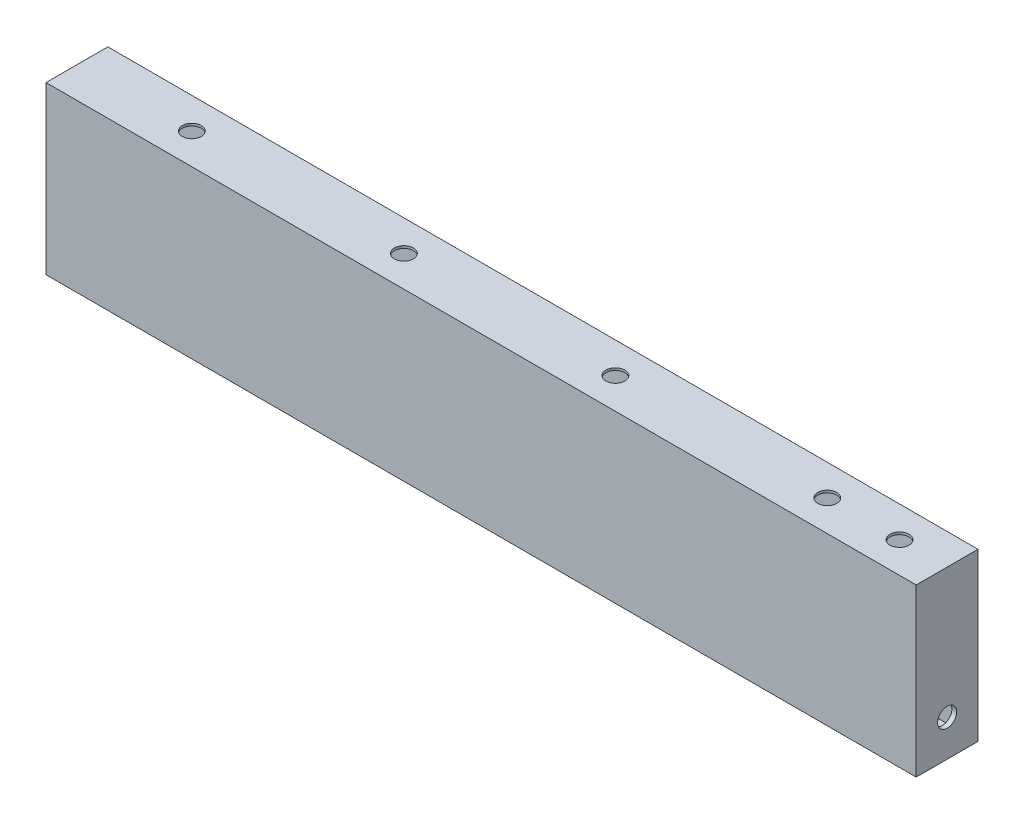
from build123d import *

# Parameters (mm, degrees)
SKETCH1_W           = 1830
SKETCH1_H           = 130
BOSS_EXTRUDE1_DEPTH = 175
SKETCH4_R           = 12.75
CUT_EXTRUDE1_DEPTH  = 64
SHELL1_START        = -55
SHELL1_OUTLINE_W    = 1810
SHELL1_OUTLINE_H    = 335
SHELL1_OUTLINE_R    = 22.75
SHELL1_DEPTH        = 110
SHELL1_START_2      = 9
SHELL1_2_OUTLINE_R  = 22.75
SHELL1_2_DEPTH      = 46
SKETCH5_R           = 20
CUT_EXTRUDE2_DEPTH  = 64
SKETCH6_R           = 20
CUT_EXTRUDE4_DEPTH  = 39
SKETCH7_R           = 20
CUT_EXTRUDE5_DEPTH  = 50
SKETCH9_R           = 20
CUT_EXTRUDE6_DEPTH  = 50


with BuildPart() as part:
    # Sketch1 → Boss-Extrude1 (new, symmetric)
    with BuildSketch(Plane(origin=(0, 0, 0), x_dir=(1, 0, 0), z_dir=(0, 1, 0))):
        Rectangle(SKETCH1_W, SKETCH1_H)
    extrude(amount=BOSS_EXTRUDE1_DEPTH, both=True)

    # Sketch4 → Cut-Extrude1 (cut)
    with BuildSketch(Plane(origin=(0, 0, -65), x_dir=(-1, 0, 0), z_dir=(0, 0, -1))):
        with Locations((-699.9, 80)):
            Circle(SKETCH4_R)
        with Locations((-619.9, 80)):
            Circle(SKETCH4_R)
        with Locations((-259.9, 80)):
            Circle(SKETCH4_R)
        with Locations((-179.9, 80)):
            Circle(SKETCH4_R)
        with Locations((180.1, 80)):
            Circle(SKETCH4_R)
        with Locations((260.1, 80)):
            Circle(SKETCH4_R)
        with Locations((620.1, 80)):
            Circle(SKETCH4_R)
        with Locations((700.1, 80)):
            Circle(SKETCH4_R)
    extrude(amount=-CUT_EXTRUDE1_DEPTH, mode=Mode.SUBTRACT)

    # Shell1: read off the stored shape, not the designer's step
    # Shell1 outline → Shell1 (cut)
    with BuildSketch(Plane.XY.offset(SHELL1_START)):
        with Locations((0, 2.5)):
            Rectangle(SHELL1_OUTLINE_W, SHELL1_OUTLINE_H)
        with Locations((-700.1, 80)):
            Circle(SHELL1_OUTLINE_R, mode=Mode.SUBTRACT)
        with Locations((-620.1, 80)):
            Circle(SHELL1_OUTLINE_R, mode=Mode.SUBTRACT)
        with Locations((-260.1, 80)):
            Circle(SHELL1_OUTLINE_R, mode=Mode.SUBTRACT)
        with Locations((-180.1, 80)):
            Circle(SHELL1_OUTLINE_R, mode=Mode.SUBTRACT)
        with Locations((179.9, 80)):
            Circle(SHELL1_OUTLINE_R, mode=Mode.SUBTRACT)
        with Locations((259.9, 80)):
            Circle(SHELL1_OUTLINE_R, mode=Mode.SUBTRACT)
        with Locations((619.9, 80)):
            Circle(SHELL1_OUTLINE_R, mode=Mode.SUBTRACT)
        with Locations((699.9, 80)):
            Circle(SHELL1_OUTLINE_R, mode=Mode.SUBTRACT)
    extrude(amount=SHELL1_DEPTH, mode=Mode.SUBTRACT)

    # Shell1 2 outline → Shell1 2 (cut)
    with BuildSketch(Plane.XY.offset(SHELL1_START_2)):
        with Locations((-700.1, 80)):
            Circle(SHELL1_2_OUTLINE_R)
        with Locations((-620.1, 80)):
            Circle(SHELL1_2_OUTLINE_R)
        with Locations((-260.1, 80)):
            Circle(SHELL1_2_OUTLINE_R)
        with Locations((-180.1, 80)):
            Circle(SHELL1_2_OUTLINE_R)
        with Locations((179.9, 80)):
            Circle(SHELL1_2_OUTLINE_R)
        with Locations((259.9, 80)):
            Circle(SHELL1_2_OUTLINE_R)
        with Locations((619.9, 80)):
            Circle(SHELL1_2_OUTLINE_R)
        with Locations((699.9, 80)):
            Circle(SHELL1_2_OUTLINE_R)
    extrude(amount=SHELL1_2_DEPTH, mode=Mode.SUBTRACT)

    # Sketch5 → Cut-Extrude2 (cut)
    with BuildSketch(Plane(origin=(0, 175, 0), x_dir=(1, 0, 0), z_dir=(0, 1, 0))):
        with Locations(Location((815, 0, 0), (0, 0, 270))):
            Circle(SKETCH5_R)
    extrude(amount=-CUT_EXTRUDE2_DEPTH, mode=Mode.SUBTRACT)

    # Sketch6 → Cut-Extrude4 (cut)
    with BuildSketch(Plane.ZY.offset(915)):
        with Locations((0, -50)):
            Circle(SKETCH6_R)
    extrude(amount=-CUT_EXTRUDE4_DEPTH, mode=Mode.SUBTRACT)

    # Sketch7 → Cut-Extrude5 (cut)
    with BuildSketch(Plane(origin=(0, 175, 0), x_dir=(1, 0, 0), z_dir=(0, 1, 0))):
        with Locations(Location((662.9, 0.1, 0), (0, 0, 270))):
            Circle(SKETCH7_R)
        with Locations(Location((217.3, 0.1, 0), (0, 0, 270))):
            Circle(SKETCH7_R)
        with Locations(Location((-227.5, 0.1, 0), (0, 0, 270))):
            Circle(SKETCH7_R)
        with Locations(Location((-673.4, 0.1, 0), (0, 0, 270))):
            Circle(SKETCH7_R)
    extrude(amount=-CUT_EXTRUDE5_DEPTH, mode=Mode.SUBTRACT)

    # Sketch9 → Cut-Extrude6 (cut)
    with BuildSketch(Plane(origin=(915, 0, 0), x_dir=(0, 0, -1), z_dir=(1, 0, 0))):
        with Locations((0.1, -98.5)):
            Circle(SKETCH9_R)
    extrude(amount=-CUT_EXTRUDE6_DEPTH, mode=Mode.SUBTRACT)


solid = part.part
